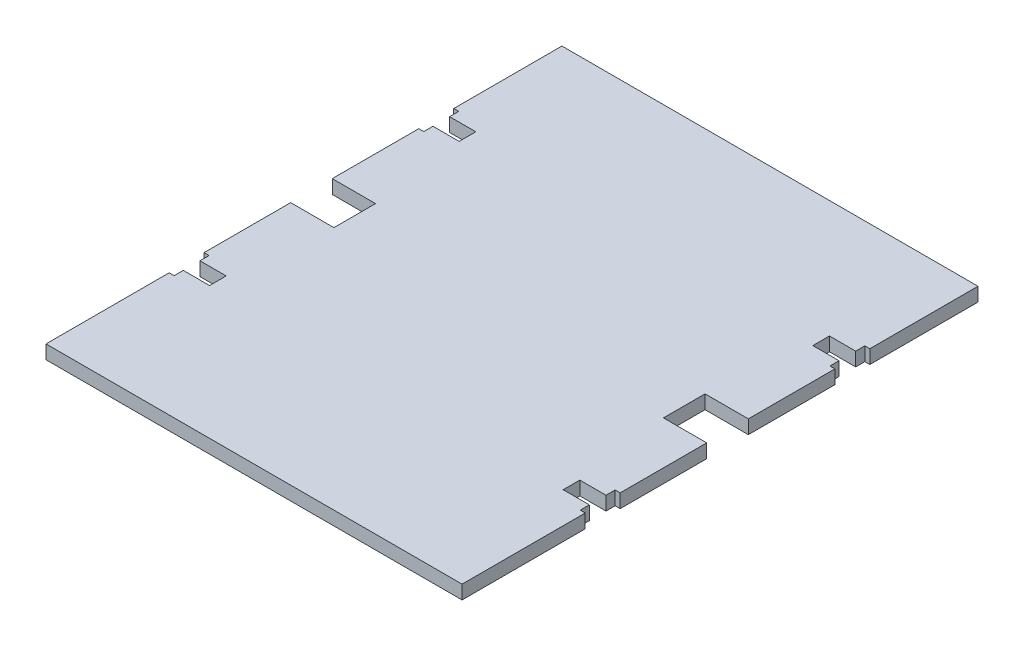
from build123d import *

# Parameters (mm, degrees)
SKETCH1_W           = 500
SKETCH1_H           = 620
BOSS_EXTRUDE1_DEPTH = 16.5
SKETCH2_W           = 52
SKETCH2_H           = 50
CUT_EXTRUDE1_DEPTH  = 399.587819683


with BuildPart() as part:
    # Sketch1 → Boss-Extrude1 (new body)
    with BuildSketch(Plane(origin=(0, 0, 0), x_dir=(1, 0, 0), z_dir=(0, 1, 0))):
        Rectangle(SKETCH1_W, SKETCH1_H)
    extrude(amount=BOSS_EXTRUDE1_DEPTH)

    # Sketch2 → Cut-Extrude1 (cut, through all)
    with BuildSketch(Plane(origin=(0, 16.5, 0), x_dir=(1, 0, 0), z_dir=(0, 1, 0))):
        with Locations((-224, 9)):
            Rectangle(SKETCH2_W, SKETCH2_H)
        with Locations((224, 9)):
            Rectangle(SKETCH2_W, SKETCH2_H)
        Polygon((-250, 180), (-244, 180), (-244, 169), (-212.5, 169), (-212.5, 149), (-244, 149), (-244, 138), (-250, 138), align=None)
        Polygon((212.5, 169), (212.5, 149), (244, 149), (244, 138), (250, 138), (250, 180), (244, 180), (244, 169), align=None)
        Polygon((212.5, -131), (212.5, -151), (244, -151), (244, -162), (250, -162), (250, -120), (244, -120), (244, -131), align=None)
        Polygon((-250, -120), (-244, -120), (-244, -131), (-212.5, -131), (-212.5, -151), (-244, -151), (-244, -162), (-250, -162), align=None)
    extrude(amount=-CUT_EXTRUDE1_DEPTH, mode=Mode.SUBTRACT)


solid = part.part
